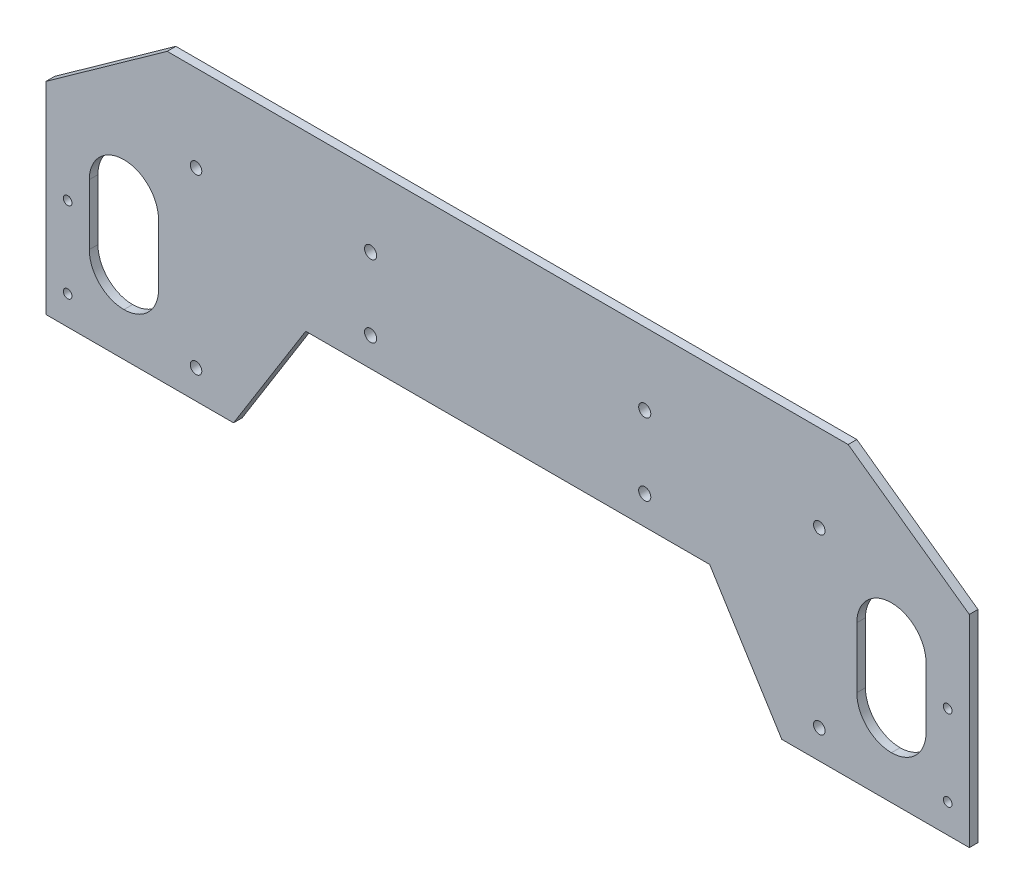
from build123d import *

# Parameters (mm, degrees)
SKETCH_1_W                  = 320
SKETCH_1_H                  = 100
EXTRUDE_1_DEPTH             = 3
HOLE_WIZARD_4_0_4_1_D       = 4
HOLE_WIZARD_4_2_4_2_1_D     = 4.2
PATTERN_LINEAR_1_COUNT      = 2
PATTERN_LINEAR_1_PITCH      = 95
PATTERN_LINEAR_1_COUNT_DIR2 = 2
PATTERN_LINEAR_1_PITCH_DIR2 = 25
CUT_EXTRUDE_1_DEPTH         = 3
SKETCH_8_W                  = 24
SKETCH_8_H                  = 45
CUT_EXTRUDE_6_DEPTH         = 3
PATTERN_LINEAR_2_COUNT      = 2
PATTERN_LINEAR_2_PITCH      = 60
PATTERN_LINEAR_2_COPY_1_D   = 4
HOLE_WIZARD_3_0_3_1_D       = 3
CUT_EXTRUDE_8_DEPTH         = 3
FILLET_1_R                  = 12


with BuildPart() as part:
    # 草图1 → 凸台-拉伸1 (new body)
    with BuildSketch(Plane.XY):
        Rectangle(SKETCH_1_W, SKETCH_1_H)
    extrude(amount=EXTRUDE_1_DEPTH)

    # Ø4.0 (4) 直径孔1 (through all)
    with Locations(Plane(origin=(0, 0, 0), x_dir=(-1, 0, 0), z_dir=(0, 0, -1))):
        with Locations((108, -40)):
            hole_wizard_4_0_4_1 = Hole(HOLE_WIZARD_4_0_4_1_D / 2)

    # 镜向1: Ø4.0 (4) 直径孔1 across plane
    add(hole_wizard_4_0_4_1.mirror(Plane(origin=(0, 0, 0), x_dir=(0, 0, 1), z_dir=(1, 0, 0))), mode=Mode.SUBTRACT)

    # Ø4.2 (4.2) 直径孔1 (through all)
    with Locations(Plane(origin=(0, 0, 0), x_dir=(-1, 0, 0), z_dir=(0, 0, -1))):
        with Locations((47.5, 0)):
            hole_wizard_4_2_4_2_1 = Hole(HOLE_WIZARD_4_2_4_2_1_D / 2)

    # 阵列(线性)1: Hole Wizard 4.2 _4.2_ _1 2 × 2
    with Locations(*[(i * PATTERN_LINEAR_1_PITCH, j * PATTERN_LINEAR_1_PITCH_DIR2, 0) for i in range(PATTERN_LINEAR_1_COUNT) for j in range(PATTERN_LINEAR_1_COUNT_DIR2) if (i, j) != (0, 0)]):
        add(hole_wizard_4_2_4_2_1, mode=Mode.SUBTRACT)

    # 草图6 → 切除-拉伸1 (cut)
    with BuildSketch(Plane(origin=(0, 0, 0), x_dir=(-1, 0, 0), z_dir=(0, 0, -1))):
        Polygon((0, -50), (0, -10), (70, -10), (95, -50), align=None)
    cut_extrude_1 = extrude(amount=-CUT_EXTRUDE_1_DEPTH, mode=Mode.SUBTRACT)

    # 镜向2: 切除-拉伸1 across plane
    add(cut_extrude_1.mirror(Plane(origin=(0, -50, 3), x_dir=(0, 0, 1), z_dir=(1, 0, 0))), mode=Mode.SUBTRACT)

    # 草图8 → 切除-拉伸6 (cut)
    with BuildSketch(Plane(origin=(0, 0, 0), x_dir=(-1, 0, 0), z_dir=(0, 0, -1))):
        with Locations((-133, -12.5)):
            Rectangle(SKETCH_8_W, SKETCH_8_H)
    cut_extrude_6 = extrude(amount=-CUT_EXTRUDE_6_DEPTH, mode=Mode.SUBTRACT)

    # 镜向4: 切除-拉伸6 across plane
    add(cut_extrude_6.mirror(Plane(origin=(0, 0, 0), x_dir=(0, 0, 1), z_dir=(1, 0, 0))), mode=Mode.SUBTRACT)

    # 阵列(线性)2: Ø4.0 (4) 直径孔1 ×2
    with Locations(*[(0, i * PATTERN_LINEAR_2_PITCH, 0) for i in range(1, PATTERN_LINEAR_2_COUNT)]):
        add(hole_wizard_4_0_4_1, mode=Mode.SUBTRACT)

    # 阵列(线性)2 copy 1 (through all)
    with Locations(Plane(origin=(0, 60, 0), x_dir=(1, 0, 0), z_dir=(0, 0, -1))):
        with Locations((108, 40)):
            Hole(PATTERN_LINEAR_2_COPY_1_D / 2)

    # Ø3.0 (3) 直径孔1 (through all)
    with Locations(Plane.XY.offset(3)):
        with Locations((-152.5, -40), (-152.5, -12)):
            hole_wizard_3_0_3_1 = Hole(HOLE_WIZARD_3_0_3_1_D / 2)

    # 草图11 → 切除-拉伸8 (cut)
    with BuildSketch(Plane.XY.offset(3)):
        Polygon((-118, 50), (-160, 50), (-160, 20), align=None)
    cut_extrude_8 = extrude(amount=-CUT_EXTRUDE_8_DEPTH, mode=Mode.SUBTRACT)

    # 镜向6: 切除-拉伸8 across plane
    add(cut_extrude_8.mirror(Plane(origin=(0, 0, 0), x_dir=(0, 0, 1), z_dir=(1, 0, 0))), mode=Mode.SUBTRACT)

    # 镜向7: Ø3.0 (3) 直径孔1 across plane
    add(hole_wizard_3_0_3_1.mirror(Plane(origin=(0, 0, 0), x_dir=(0, 0, 1), z_dir=(1, 0, 0))), mode=Mode.SUBTRACT)

    # 圆角1
    fillet_1_edges = [part.edges().sort_by_distance(p)[0] for p in [
        (145, -35, 1.5),
        (121, -35, 1.5),
        (145, 10, 1.5),
        (121, 10, 1.5),
        (-145, -35, 1.5),
        (-121, -35, 1.5),
        (-145, 10, 1.5),
        (-121, 10, 1.5),
    ]]
    fillet(fillet_1_edges, radius=FILLET_1_R - 0.0001)  # a hair under: the kernel refuses the full size


solid = part.part
